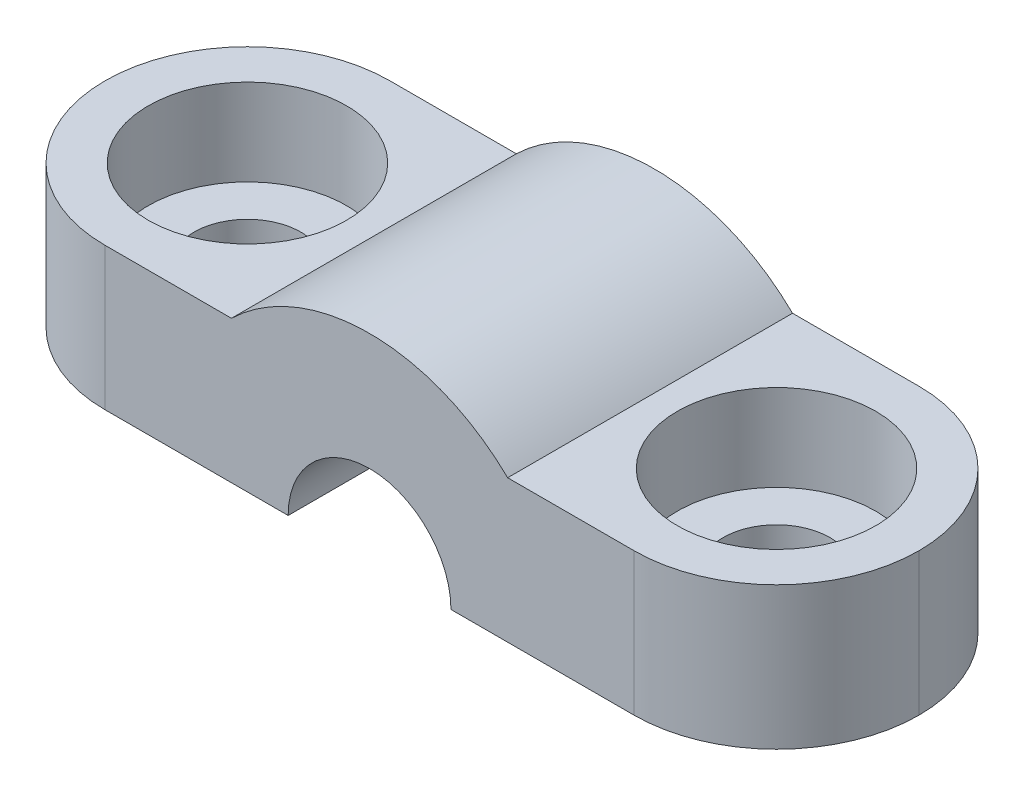
from build123d import *

# Parameters (mm, degrees)
SKETCH1_W           = 40
SKETCH1_H           = 14
BOSS_EXTRUDE1_DEPTH = 7
FILLET1_R           = 7
SKETCH2_R           = 2.625
CUT_EXTRUDE1_DEPTH  = 23.315913604
SKETCH3_R           = 4.875
CUT_EXTRUDE2_DEPTH  = 4.25
BOSS_EXTRUDE2_DEPTH = 14
SKETCH5_R           = 4
CUT_EXTRUDE3_DEPTH  = 27.288067635


with BuildPart() as part:
    # Sketch1 → Boss-Extrude1 (new body)
    with BuildSketch(Plane(origin=(0, 0, 0), x_dir=(1, 0, 0), z_dir=(0, 1, 0))):
        Rectangle(SKETCH1_W, SKETCH1_H)
    extrude(amount=BOSS_EXTRUDE1_DEPTH)

    # Fillet1
    fillet1_edges = [part.edges().sort_by_distance(p)[0] for p in [
        (-20, 3.5, 7),
        (20, 3.5, 7),
        (20, 3.5, -7),
        (-20, 3.5, -7),
    ]]
    fillet(fillet1_edges, radius=FILLET1_R - 0.0001)  # a hair under: the kernel refuses the full size

    # Sketch2 → Cut-Extrude1 (cut, through all)
    with BuildSketch(Plane(origin=(0, 7, 0), x_dir=(1, 0, 0), z_dir=(0, 1, 0))):
        with Locations(Location((-13, 0, 0), (0, 0, 270))):
            Circle(SKETCH2_R)
        with Locations(Location((13, 0, 0), (0, 0, 90))):
            Circle(SKETCH2_R)
    extrude(amount=-CUT_EXTRUDE1_DEPTH, mode=Mode.SUBTRACT)

    # Sketch3 → Cut-Extrude2 (cut)
    with BuildSketch(Plane(origin=(0, 7, 0), x_dir=(1, 0, 0), z_dir=(0, 1, 0))):
        with Locations(Location((-13, 0, 0), (0, 0, 270))):
            Circle(SKETCH3_R)
        with Locations(Location((13, 0, 0), (0, 0, 90))):
            Circle(SKETCH3_R)
    extrude(amount=-CUT_EXTRUDE2_DEPTH, mode=Mode.SUBTRACT)

    # Sketch4 → Boss-Extrude2 (add)
    with BuildSketch(Plane.XY.offset(7)):
        with BuildLine():
            Line((6.78693598, 7), (-6.78693598, 7))
            ThreePointArc((-6.78693598, 7), (0, 9.75), (6.78693598, 7))
        make_face()
    extrude(amount=-BOSS_EXTRUDE2_DEPTH)

    # Sketch5 → Cut-Extrude3 (cut, through all)
    with BuildSketch(Plane.XY.offset(7)):
        Circle(SKETCH5_R)
    extrude(amount=-CUT_EXTRUDE3_DEPTH, mode=Mode.SUBTRACT)


solid = part.part
